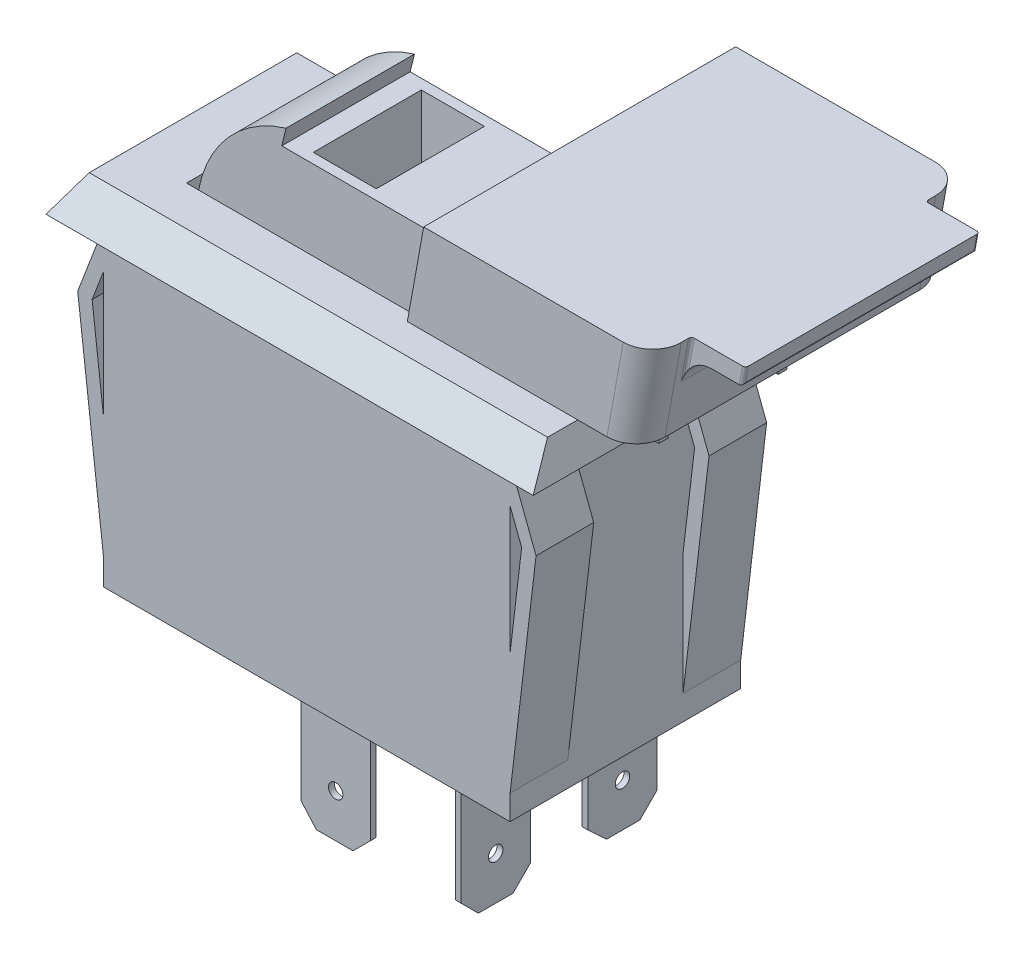
from build123d import *

# Parameters (mm, degrees)
SKETCH1_W                = 42.926
SKETCH1_H                = 23.368
BOSS_EXTRUDE1_DEPTH      = 29.972
SKETCH2_W                = 42.926
SKETCH2_H                = 23.368
SKETCH2_W_2              = 35.814
SKETCH2_H_2              = 20.32
CUT_EXTRUDE1_DEPTH       = 27.432
CUT_EXTRUDE3_DEPTH       = 58.332588325
CUT_EXTRUDE4_DEPTH       = 58.332588325
SKETCH6_W                = 30.226
SKETCH6_H                = 11.308118352
CUT_EXTRUDE5_DEPTH       = 7.62
BOSS_EXTRUDE2_DEPTH      = 20.32
SKETCH9_W                = 9.398
SKETCH9_H                = 0.508
SKETCH9_W_2              = 0.508
SKETCH9_H_2              = 6.096
BOSS_EXTRUDE3_DEPTH      = 11.43
CUT_EXTRUDE6_REACH       = 52.68
SKETCH10_R               = 0.635
SKETCH11_R               = 0.635
CUT_EXTRUDE7_DEPTH       = 56.888081234
BOSS_EXTRUDE7_DEPTH      = 11.308118351
CUT_EXTRUDE8_REACH       = 74.758
SKETCH13_W               = 10.16
SKETCH13_H               = 24.400758564
SKETCH14_W               = 10.16
SKETCH14_H               = 24.400758564
CUT_EXTRUDE9_DEPTH       = 12.7
BOSS_EXTRUDE8_DEPTH      = 1.8415
BOSS_EXTRUDE8_DEPTH_BACK = 25.654
SKETCH17_W               = 3.429
SKETCH17_H               = 2.254926229
SKETCH17_H_2             = 1.5875
CUT_EXTRUDE11_DEPTH      = 4.686333783
FILLET2_R                = 2.54
FILLET3_R                = 2.54
FILLET6_R                = 0.254
CUT_EXTRUDE12_START      = -6.096
CUT_EXTRUDE12_OUTLINE_W  = 14.172661673
CUT_EXTRUDE12_OUTLINE_H  = 9.720618352
CUT_EXTRUDE12_DEPTH      = 6.096
CUT_EXTRUDE13_DEPTH      = 2.54
SKETCH20_W               = 5.55625
SKETCH20_H               = 9.525
CUT_EXTRUDE14_DEPTH      = 12.7


# Read off the part's stored shape, not the designer's step: Cut-Extrude12
with BuildPart() as part:
    # Sketch1 → Boss-Extrude1 (new body)
    with BuildSketch(Plane(origin=(0, 0, 0), x_dir=(1, 0, 0), z_dir=(0, 1, 0))):
        with Locations((21.463, 11.684)):
            Rectangle(SKETCH1_W, SKETCH1_H)
    extrude(amount=BOSS_EXTRUDE1_DEPTH)

    # Sketch2 → Cut-Extrude1 (cut)
    with BuildSketch(Plane.XZ):
        with Locations((21.463, -11.684)):
            Rectangle(SKETCH2_W, SKETCH2_H)
        with Locations((21.463, -11.684)):
            Rectangle(SKETCH2_W_2, SKETCH2_H_2, mode=Mode.SUBTRACT)
    extrude(amount=-CUT_EXTRUDE1_DEPTH, mode=Mode.SUBTRACT)

    # Sketch5 → Cut-Extrude3 (cut, through all)
    with BuildSketch(Plane.XY):
        Polygon((0, 29.972), (0, 27.432), (1.27, 29.972), align=None)
        Polygon((42.926, 29.972), (42.926, 27.432), (41.656, 29.972), align=None)
    extrude(amount=-CUT_EXTRUDE3_DEPTH, mode=Mode.SUBTRACT)

    # Sketch3 → Cut-Extrude4 (cut, through all)
    with BuildSketch(Plane.ZY):
        Polygon((-23.368, 27.432), (-20.828, 29.972), (-23.368, 29.972), align=None)
        Polygon((0, 27.432), (0, 29.972), (-2.54, 29.972), align=None)
    extrude(amount=-CUT_EXTRUDE4_DEPTH, mode=Mode.SUBTRACT)

    # Sketch6 → Cut-Extrude5 (cut)
    with BuildSketch(Plane(origin=(0, 29.972, 0), x_dir=(1, 0, 0), z_dir=(0, 1, 0))):
        with Locations((21.463, 11.684)):
            Rectangle(SKETCH6_W, SKETCH6_H)
    extrude(amount=-CUT_EXTRUDE5_DEPTH, mode=Mode.SUBTRACT)

    # Sketch7 → Boss-Extrude2 (add)
    with BuildSketch(Plane.XY.offset(-1.524)):
        Polygon((3.556, 12.874989672), (2.54, 21.433276772), (1.27, 21.433276772), (3.556, 2.177130797), align=None)
        Polygon((2.54, 21.433276772), (3.556, 24.093595202), (3.556, 27.418993238), (1.27, 21.433276772), align=None)
        Polygon((39.37, 2.177130797), (41.656, 21.433276772), (40.386, 21.433276772), (39.37, 12.874989672), align=None)
        Polygon((41.656, 21.433276772), (39.37, 27.418993238), (39.37, 24.093595202), (40.386, 21.433276772), align=None)
    extrude(amount=-BOSS_EXTRUDE2_DEPTH)

    # Sketch9 → Boss-Extrude3 (add)
    with BuildSketch(Plane.XZ):
        with Locations((21.717, -19.304)):
            Rectangle(SKETCH9_W, SKETCH9_H)
        with Locations((21.717, -4.064)):
            Rectangle(SKETCH9_W, SKETCH9_H)
        with Locations((33.274, -6.096)):
            Rectangle(SKETCH9_W_2, SKETCH9_H_2)
        with Locations((33.274, -17.272)):
            Rectangle(SKETCH9_W_2, SKETCH9_H_2)
    extrude(amount=BOSS_EXTRUDE3_DEPTH)

    # Sketch10 → Cut-Extrude6 (cut, up to next)
    with BuildSketch(Plane(origin=(33.528, 0, 0), x_dir=(0, 0, -1), z_dir=(1, 0, 0)), mode=Mode.PRIVATE) as cut_extrude6_sk1:
        Polygon((18.796, -11.43), (20.32, -11.43), (20.32, -9.906), align=None)
    cut_extrude6_tool1 = extrude(cut_extrude6_sk1.sketch, amount=-CUT_EXTRUDE6_REACH, mode=Mode.PRIVATE) & part.part
    # Sketch10 → Cut-Extrude6 (cut, up to next)
    with BuildSketch(Plane(origin=(33.528, 0, 0), x_dir=(0, 0, -1), z_dir=(1, 0, 0)), mode=Mode.PRIVATE) as cut_extrude6_sk2:
        Polygon((14.224, -9.906), (14.224, -11.43), (15.857916608, -11.43), align=None)
    cut_extrude6_tool2 = extrude(cut_extrude6_sk2.sketch, amount=-CUT_EXTRUDE6_REACH, mode=Mode.PRIVATE) & part.part
    # Sketch10 → Cut-Extrude6 (cut, up to next)
    with BuildSketch(Plane(origin=(33.528, 0, 0), x_dir=(0, 0, -1), z_dir=(1, 0, 0)), mode=Mode.PRIVATE) as cut_extrude6_sk3:
        Polygon((3.048, -9.906), (3.048, -11.43), (4.572, -11.43), align=None)
    cut_extrude6_tool3 = extrude(cut_extrude6_sk3.sketch, amount=-CUT_EXTRUDE6_REACH, mode=Mode.PRIVATE) & part.part
    # Sketch10 → Cut-Extrude6 (cut, up to next)
    with BuildSketch(Plane(origin=(33.528, 0, 0), x_dir=(0, 0, -1), z_dir=(1, 0, 0)), mode=Mode.PRIVATE) as cut_extrude6_sk4:
        Polygon((7.62, -11.43), (9.144, -11.43), (9.144, -9.906), align=None)
    cut_extrude6_tool4 = extrude(cut_extrude6_sk4.sketch, amount=-CUT_EXTRUDE6_REACH, mode=Mode.PRIVATE) & part.part
    # Sketch10 → Cut-Extrude6 (cut, up to next)
    with BuildSketch(Plane(origin=(33.528, 0, 0), x_dir=(0, 0, -1), z_dir=(1, 0, 0)), mode=Mode.PRIVATE) as cut_extrude6_sk5:
        with Locations((6.096, -7.62)):
            Circle(SKETCH10_R)
    cut_extrude6_tool5 = extrude(cut_extrude6_sk5.sketch, amount=-CUT_EXTRUDE6_REACH, mode=Mode.PRIVATE) & part.part
    # Sketch10 → Cut-Extrude6 (cut, up to next)
    with BuildSketch(Plane(origin=(33.528, 0, 0), x_dir=(0, 0, -1), z_dir=(1, 0, 0)), mode=Mode.PRIVATE) as cut_extrude6_sk6:
        with Locations((17.272, -7.62)):
            Circle(SKETCH10_R)
    cut_extrude6_tool6 = extrude(cut_extrude6_sk6.sketch, amount=-CUT_EXTRUDE6_REACH, mode=Mode.PRIVATE) & part.part
    add(cut_extrude6_tool1.solids().sort_by_distance((33.528, -10.922, -19.812))[0], mode=Mode.SUBTRACT)
    add(cut_extrude6_tool2.solids().sort_by_distance((33.528, -10.922, -14.768639))[0], mode=Mode.SUBTRACT)
    add(cut_extrude6_tool3.solids().sort_by_distance((33.528, -10.922, -3.556))[0], mode=Mode.SUBTRACT)
    add(cut_extrude6_tool4.solids().sort_by_distance((33.528, -10.922, -8.636))[0], mode=Mode.SUBTRACT)
    add(cut_extrude6_tool5.solids().sort_by_distance((33.528, -7.62, -6.096))[0], mode=Mode.SUBTRACT)
    add(cut_extrude6_tool6.solids().sort_by_distance((33.528, -7.62, -17.272))[0], mode=Mode.SUBTRACT)

    # Sketch11 → Cut-Extrude7 (cut, through all)
    with BuildSketch(Plane.XY.offset(-3.81)):
        Polygon((18.669, -0.909958284), (17.018, 0), (17.018, -11.43), (20.009868608, -11.43), (18.669, -9.906), align=None)
        with Locations((21.717, -7.62)):
            Circle(SKETCH11_R)
        Polygon((26.416, 0), (24.765, -0.909958284), (24.765, -9.906), (23.241, -11.43), (26.416, -11.43), align=None)
    extrude(amount=-CUT_EXTRUDE7_DEPTH, mode=Mode.SUBTRACT)

    # Sketch12 → Boss-Extrude7 (add)
    with BuildSketch(Plane.XY.offset(-17.338059176)):
        with BuildLine():
            Line((33.796840653, 30.910566615), (47.969502326, 30.910566615))
            Line((47.969502326, 30.910566615), (47.969502326, 37.006566615))
            Line((47.969502326, 37.006566615), (14.747400659, 37.006566615))
            Line((14.747400659, 37.006566615), (15.124125013, 38.544832274))
            ThreePointArc((15.124125013, 38.544832274), (10.069226718, 35.337937954), (7.415384629, 29.972))
            Line((7.415384629, 29.972), (33.796840653, 29.972))
            Line((33.796840653, 29.972), (33.796840653, 30.910566615))
        make_face()
        with BuildLine():
            Line((33.796840653, 27.124411179), (33.796840653, 29.972))
            Line((33.796840653, 29.972), (7.415384629, 29.972))
            ThreePointArc((7.415384629, 29.972), (7.241769578, 28.553480232), (7.251876855, 27.124411179))
            Line((7.251876855, 27.124411179), (33.796840653, 27.124411179))
        make_face()
    extrude(amount=BOSS_EXTRUDE7_DEPTH)

    # Cut-Extrude8: up to this face of the body (flat: up to its plane)
    cut_extrude8_end = Plane(part.part.faces().sort_by_distance((3.556, 1.088565398, -11.684))[0])
    # Sketch13 → Cut-Extrude8 (cut, up to the picked face)
    with BuildSketch(Plane.ZY.offset(9.144), mode=Mode.PRIVATE) as cut_extrude8_sk1:
        with Locations((-11.684, 14.377510079)):
            Rectangle(SKETCH13_W, SKETCH13_H)
    cut_extrude8_tool1 = split(extrude(cut_extrude8_sk1.sketch, amount=-CUT_EXTRUDE8_REACH, mode=Mode.PRIVATE), bisect_by=cut_extrude8_end, keep=Keep.BOTH, mode=Mode.PRIVATE)
    add(cut_extrude8_tool1.solids().sort_by(Axis((-9.144, 14.37751, -11.684), (1, 0, 0)))[0], mode=Mode.SUBTRACT)

    # Sketch14 → Cut-Extrude9 (cut)
    with BuildSketch(Plane(origin=(52.07, 0, 0), x_dir=(0, 0, -1), z_dir=(1, 0, 0))):
        with Locations((11.684, 14.377510079)):
            Rectangle(SKETCH14_W, SKETCH14_H)
    extrude(amount=-CUT_EXTRUDE9_DEPTH, mode=Mode.SUBTRACT)

    # Cut-Extrude12 outline → Cut-Extrude12 (cut)
    with BuildSketch(Plane.XZ.offset(-30.910566615).offset(CUT_EXTRUDE12_START)):
        with Locations((40.88317149, -11.684)):
            Rectangle(CUT_EXTRUDE12_OUTLINE_W, CUT_EXTRUDE12_OUTLINE_H)
    extrude(amount=CUT_EXTRUDE12_DEPTH, mode=Mode.SUBTRACT)

    # Sketch20 → Cut-Extrude14 (cut)
    with BuildSketch(Plane(origin=(0, 37.006566615, 0), x_dir=(1, 0, 0), z_dir=(0, 1, 0))):
        with Locations((19.406889706, 11.684)):
            Rectangle(SKETCH20_W, SKETCH20_H)
    extrude(amount=-CUT_EXTRUDE14_DEPTH, mode=Mode.SUBTRACT)


with BuildPart() as body_2:
    # Sketch15 → Boss-Extrude8 (new, two sides: drawn at the far end of the back side and taken through both)
    with BuildSketch(Plane.XY.offset(-BOSS_EXTRUDE8_DEPTH_BACK)):
        Polygon((33.682002326, 37.006566615), (47.969502326, 37.006566615), (53.848269551, 37.006566615), (55.002370372, 43.381955354), (55.285150601, 44.944066615), (35.118883377, 44.944066615), align=None)
        Polygon((55.285150601, 44.944066615), (55.002370372, 43.381955354), (59.764870372, 43.381955354), (60.047650601, 44.944066615), align=None)
    extrude(amount=BOSS_EXTRUDE8_DEPTH + BOSS_EXTRUDE8_DEPTH_BACK)

    # Sketch17 → Cut-Extrude11 (cut)
    with BuildSketch(Plane(origin=(50.264518988, -9.099103601, 0), x_dir=(0, 0, -1), z_dir=(0.9840070935891015, -0.17812927824007313, 0))):
        with Locations((-0.127, 52.206561912)):
            Rectangle(SKETCH17_W, SKETCH17_H)
        with Locations((-0.127, 54.127775026)):
            Rectangle(SKETCH17_W, SKETCH17_H_2)
        with Locations((23.9395, 52.206561912)):
            Rectangle(SKETCH17_W, SKETCH17_H)
        with Locations((23.9395, 54.127775026)):
            Rectangle(SKETCH17_W, SKETCH17_H_2)
    extrude(amount=-CUT_EXTRUDE11_DEPTH, mode=Mode.SUBTRACT)

    # Fillet2
    fillet2_edges = [body_2.edges().sort_by_distance(p)[0] for p in [
        (54.425319961, 40.194260985, 1.8415),
        (54.425319961, 40.194260985, -25.654),
    ]]
    fillet(fillet2_edges, radius=FILLET2_R)

    # Fillet3
    fillet3_edges = [body_2.edges().sort_by_distance(p)[0] for p in [
        (55.002370372, 43.381955354, -11.90625),
    ]]
    fillet(fillet3_edges, radius=FILLET3_R)

    # Fillet6
    fillet6_edges = [body_2.edges().sort_by_distance(p)[0] for p in [
        (59.764870372, 43.381955354, -11.90625),
        (59.906260486, 44.163010985, -1.5875),
        (54.813421497, 42.338179537, -1.5875),
        (59.906260486, 44.163010985, -22.225),
        (54.813421497, 42.338179537, -22.225),
    ]]
    fillet(fillet6_edges, radius=FILLET6_R)

    # Sketch19 → Cut-Extrude13 (cut)
    with BuildSketch(Plane.XZ.offset(-37.006566615)):
        with BuildLine():
            Line((34.475752326, 0.525663982), (34.475752326, -6.029940824))
            Line((34.475752326, -6.029940824), (47.969502326, -6.029940824))
            Line((47.969502326, -6.029940824), (53.054519551, -6.029940824))
            Line((53.054519551, -6.029940824), (53.054519551, -2.014336018))
            ThreePointArc((53.054519551, -2.014336018), (52.310570775, -0.218284794), (50.514519551, 0.525663982))
            Line((50.514519551, 0.525663982), (34.475752326, 0.525663982))
        make_face()
        Polygon((47.969502326, -6.823690824), (34.475752326, -6.823690824), (34.475752326, -16.544309176), (47.969502326, -16.544309176), (53.054519551, -16.544309176), (53.054519551, -6.823690824), align=None)
        with BuildLine():
            Line((47.969502326, -17.338059176), (34.475752326, -17.338059176))
            Line((34.475752326, -17.338059176), (34.475752326, -24.338163982))
            Line((34.475752326, -24.338163982), (50.514519551, -24.338163982))
            ThreePointArc((50.514519551, -24.338163982), (52.310570775, -23.594215206), (53.054519551, -21.798163982))
            Line((53.054519551, -21.798163982), (53.054519551, -17.338059176))
            Line((53.054519551, -17.338059176), (47.969502326, -17.338059176))
        make_face()
    extrude(amount=-CUT_EXTRUDE13_DEPTH, mode=Mode.SUBTRACT)


solid = Compound([part.part, body_2.part])
